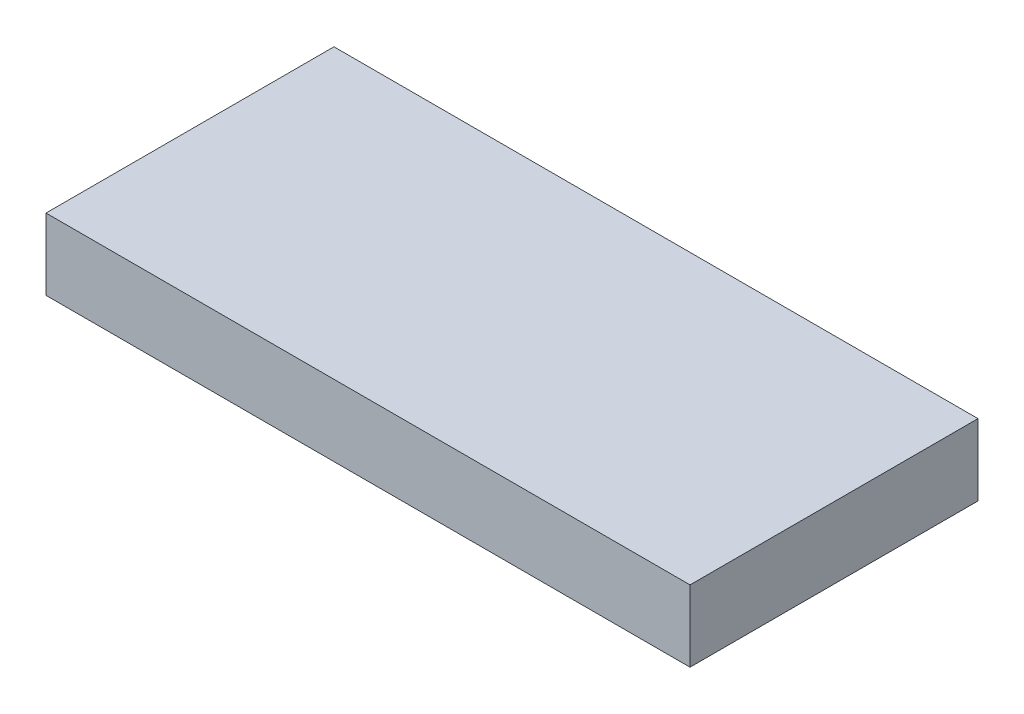
from build123d import *

# Parameters (mm, degrees)
SKETCH1_W           = 90.306324216
SKETCH1_H           = 40.378658562
BOSS_EXTRUDE1_DEPTH = 10


with BuildPart() as part:
    # Sketch1 → Boss-Extrude1 (new body)
    with BuildSketch(Plane(origin=(0, 0, 0), x_dir=(1, 0, 0), z_dir=(0, 1, 0))):
        with Locations((-0.136414387, -0.136414387)):
            Rectangle(SKETCH1_W, SKETCH1_H)
    extrude(amount=BOSS_EXTRUDE1_DEPTH)


solid = part.part
